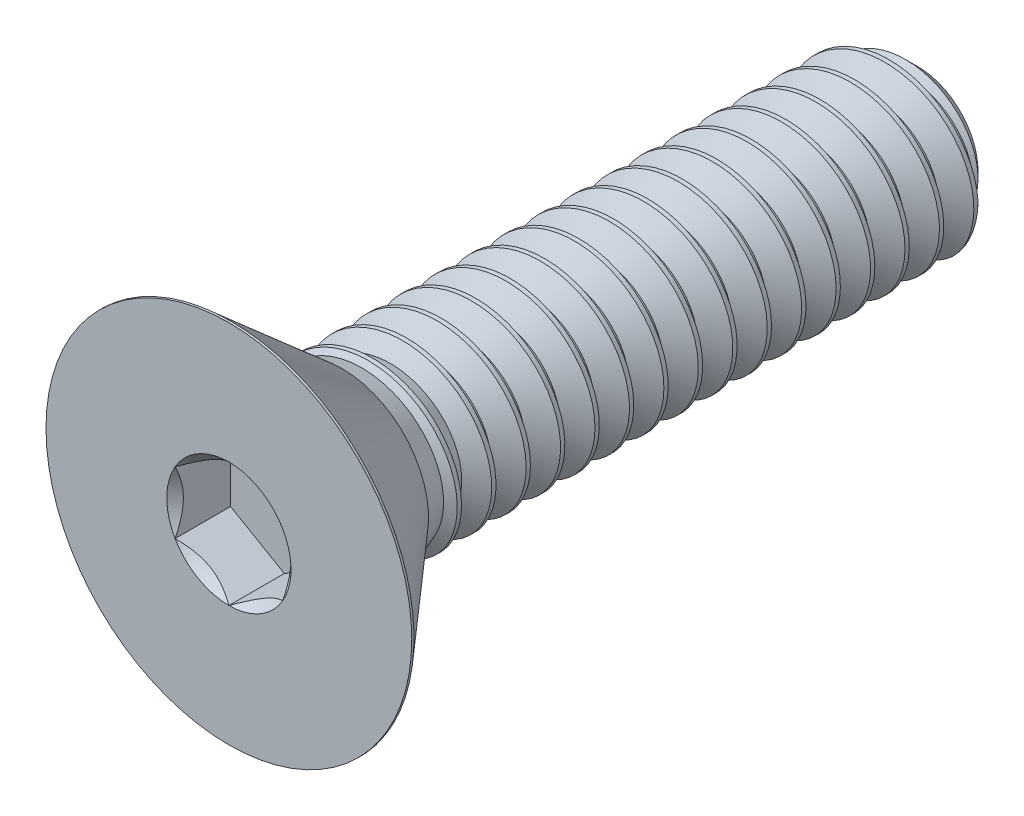
from build123d import *

# Parameters (mm, degrees)
SKETCH10_R         = 2.291358881
CUT_EXTRUDE2_DEPTH = 2.0447
CUT_EXTRUDE2_DRAFT = -45
CUT_EXTRUDE1_DEPTH = 2.0447
CUT_SWEEP1_PITCH   = 1.27
CUT_SWEEP1_TO      = 21.212892


with BuildPart() as part:
    # Sketch2 → Revolve1 (revolve)
    with BuildSketch(Plane(origin=(0, 0, 0), x_dir=(0, 0, -1), z_dir=(1, 0, 0))):
        Polygon((-12.618212, 6.7437), (-8.512892265, 3.175), (11.7475, 3.175), (12.7, 2.2225), (12.7, 0), (-12.7, 0), (-12.7, 6.7437), align=None)
    revolve(axis=Axis((0, 0, -12.7), (0, 0, 1)))


with BuildPart() as cut_extrude2_tool:
    # Sketch10 → Cut-Extrude2 (with draft: the straight prism first)
    with BuildSketch(Plane.XY.offset(12.7)):
        Circle(SKETCH10_R)
    extrude(amount=-CUT_EXTRUDE2_DEPTH)
    # Cut-Extrude2: the draft: its side faces are tilted about the plane it starts from
    cut_extrude2_sides = [cut_extrude2_tool.faces().sort_by_distance(p)[0] for p in [
        (-2.291358881, 0, 11.67765),
    ]]
    draft(cut_extrude2_sides, Plane.XY.offset(12.7), CUT_EXTRUDE2_DRAFT)


with BuildPart() as part_1:
    add(part.part)

    # Cut-Extrude2: cut by cut_extrude2_tool
    add(cut_extrude2_tool.part, mode=Mode.SUBTRACT)

    # Sketch9 → Cut-Extrude1 (cut)
    with BuildSketch(Plane.XY.offset(12.7)):
        Polygon((1.984375, -1.14567944), (1.984375, 1.14567944), (0, 2.291358881), (-1.984375, 1.14567944), (-1.984375, -1.14567944), (0, -2.291358881), align=None)
    extrude(amount=-CUT_EXTRUDE1_DEPTH, mode=Mode.SUBTRACT)


with BuildPart() as body_2:
    # Split1: the piece on the far side of the plane
    add(part_1.part)
    split(bisect_by=Plane.XY.offset(8.512892265), keep=Keep.BOTTOM)

    # Cut-Sweep1: arcs per turn and ends read off the stored shape
    # Cut-Sweep1: the profile of Sketch4 screwed along a right-hand helix through 20 turns, 8 arcs to a turn; built about Z, then put on its axis
    cut_sweep1_z = Axis((0, 0, 0), (0, 0, 1))
    cut_sweep1_corners = [(3.243740766, 0, 0.0396875), (3.243740766, 0, -1.1509375), (2.350110803, 0, -0.635), (2.350110803, 0, -0.47625)]
    with BuildLine(mode=Mode.PRIVATE) as cut_sweep1_profile:
        Line(cut_sweep1_corners[0], cut_sweep1_corners[1])
        Line(cut_sweep1_corners[1], cut_sweep1_corners[2])
        Line(cut_sweep1_corners[2], cut_sweep1_corners[3])
        Line(cut_sweep1_corners[3], cut_sweep1_corners[0])
    cut_sweep1_cap = Face(cut_sweep1_profile.wire())
    cut_sweep1_turn_angles = [0, 22.5, 45, 67.5, 90, 112.5, 135, 157.5, 180, 202.5, 225, 247.5, 270, 292.5, 315, 337.5, 360]
    cut_sweep1_turn_weights = [1, 0.9238795325112867, 1, 0.9238795325112867, 1, 0.9238795325112867, 1, 0.9238795325112867, 1, 0.9238795325112867, 1, 0.9238795325112867, 1, 0.9238795325112867, 1, 0.9238795325112867, 1]
    cut_sweep1_turn_rails = [Edge.make_bspline([Vector(p[0], p[1], 0).rotate(cut_sweep1_z, cut_sweep1_turn_angles[k]) / cut_sweep1_turn_weights[k] + Vector(0, 0, p[2] + CUT_SWEEP1_PITCH * cut_sweep1_turn_angles[k] / 360) for k in range(17)], [0, 0, 0, 1, 1, 2, 2, 3, 3, 4, 4, 5, 5, 6, 6, 7, 7, 8, 8, 8], 2, cut_sweep1_turn_weights) for p in cut_sweep1_corners]
    cut_sweep1_turn_sides = [Face.make_surface_from_curves(cut_sweep1_turn_rails[p[0]], cut_sweep1_turn_rails[p[1]]) for p in [(0, 1), (1, 2), (2, 3), (3, 0)]]
    cut_sweep1 = Plane(origin=(0, 0, -12.7), x_dir=(0, 1, 0), z_dir=(0, 0, 1)) * split(Solid(Shell([*[p.moved(Location((0, 0, CUT_SWEEP1_PITCH * i))) for i in range(20) for p in cut_sweep1_turn_sides], cut_sweep1_cap, cut_sweep1_cap.rotate(cut_sweep1_z, 7200).moved(Location((0, 0, CUT_SWEEP1_PITCH * 7200 / 360)))])), bisect_by=Plane.XY.offset(CUT_SWEEP1_TO), keep=Keep.BOTTOM, mode=Mode.PRIVATE)
    add(cut_sweep1, mode=Mode.SUBTRACT)


with BuildPart() as part_2:
    add(part_1.part)

    # Split1
    split(bisect_by=Plane.XY.offset(8.512892265), keep=Keep.TOP)

    add(body_2.part)  # Boss-Extrude2 merges body 2
    # Boss-Extrude2 cone 1 section (through the dimple's axis) → Boss-Extrude2 (revolve)
    with BuildSketch(Plane(origin=(0, 0, 8.512892265), x_dir=(0, -1, 0), z_dir=(1, 0, 0))):
        Polygon((0, 0), (3.175, 0), (0, 8.723240807), align=None)
    revolve(axis=Axis((0, 0, 8.512892265), (0, 0, -1)))


solid = part_2.part
